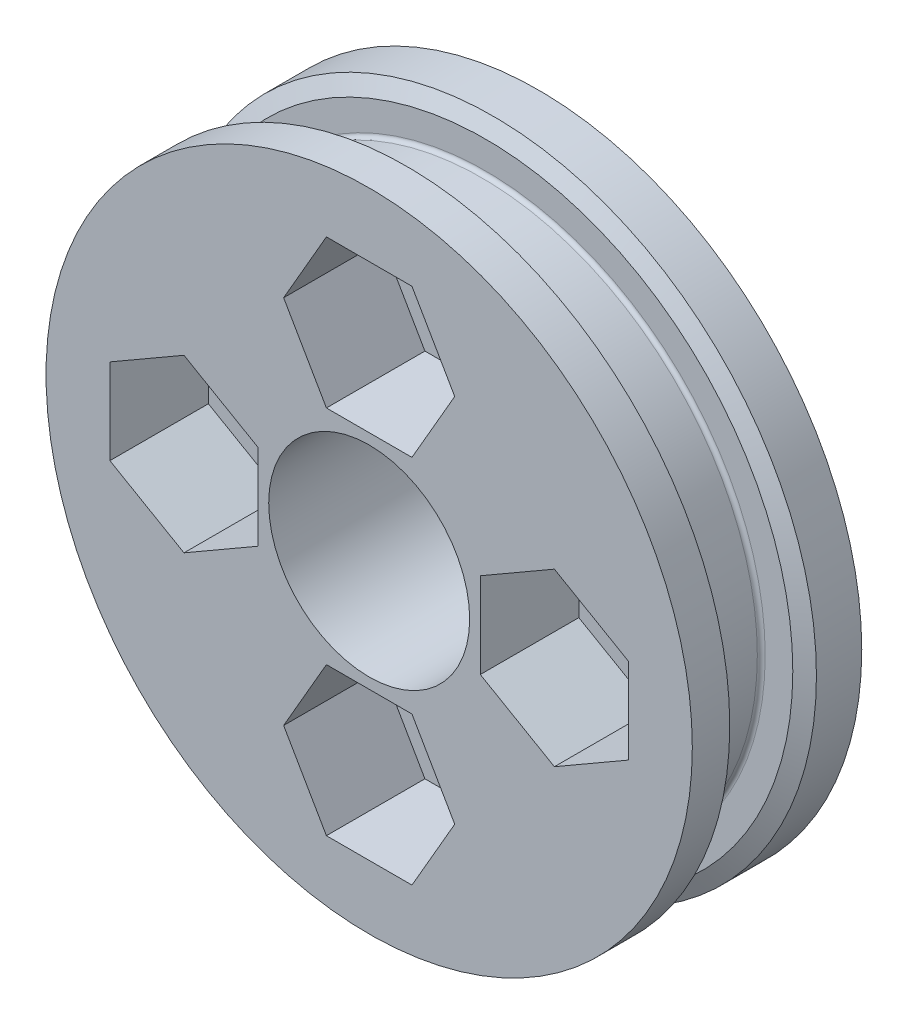
from build123d import *

# Parameters (mm, degrees)
SKETCH3_W               = 16.51
SKETCH3_H               = 16.51
SKETCH3_R               = 6.477
BOSS_EXTRUDE1_DEPTH     = 3.175
CUT_EXTRUDE1_DEPTH      = 32.414984514
CUT_EXTRUDE1_DEPTH_BACK = 32.414984514
SKETCH4_R               = 2.54
FILLET1_R               = 0.254
CUT_EXTRUDE2_DEPTH      = 6.35
CIRPATTERN1_COUNT       = 4


with BuildPart() as part:
    # Sketch2 → Revolve1 (revolve)
    with BuildSketch(Plane(origin=(0, 0, 0), x_dir=(0, 0, -1), z_dir=(1, 0, 0))):
        Polygon((0, 6.477), (0, 20.828), (2.413, 20.828), (2.921, 19.812), (2.921, 17.78), (7.493, 17.78), (7.493, 19.812), (8.001, 20.828), (10.922, 20.828), (10.922, 6.477), align=None)
    revolve(axis=Axis((0, 0, 0), (0, 0, -1)))

    # Sketch3 → Boss-Extrude1 (add)
    with BuildSketch(Plane(origin=(0, 0, -10.922), x_dir=(-1, 0, 0), z_dir=(0, 0, -1))):
        Rectangle(SKETCH3_W, SKETCH3_H)
        Circle(SKETCH3_R, mode=Mode.SUBTRACT)
    extrude(amount=BOSS_EXTRUDE1_DEPTH)

    # Sketch4 → Cut-Extrude1 (cut, two sides: drawn at the far end of the back side and taken through both)
    with BuildSketch(Plane(origin=(0, 0, -10.922), x_dir=(-1, 0, 0), z_dir=(0, 0, -1)).offset(-CUT_EXTRUDE1_DEPTH_BACK)):
        with Locations((0, 11.938)):
            Circle(SKETCH4_R)
        with Locations((11.938, 0)):
            Circle(SKETCH4_R)
        with Locations((0, -11.938)):
            Circle(SKETCH4_R)
        with Locations((-11.938, 0)):
            Circle(SKETCH4_R)
    extrude(amount=CUT_EXTRUDE1_DEPTH + CUT_EXTRUDE1_DEPTH_BACK, mode=Mode.SUBTRACT)

    # Fillet1
    fillet1_edges = [part.edges().sort_by_distance(p)[0] for p in [
        (0, -17.78, -7.493),
        (0, -17.78, -2.921),
    ]]
    fillet(fillet1_edges, radius=FILLET1_R)

    # Sketch5 → Cut-Extrude2 (cut)
    with BuildSketch(Plane.XY):
        Polygon((2.756963005, 7.1628), (5.513926011, 11.938), (2.756963005, 16.7132), (-2.756963005, 16.7132), (-5.513926011, 11.938), (-2.756963005, 7.1628), align=None)
    cut_extrude2 = extrude(amount=-CUT_EXTRUDE2_DEPTH, mode=Mode.SUBTRACT)

    # CirPattern1: Cut-Extrude2 ×4 about axis
    cirpattern1_axis = Axis((0, 0, 0), (0, 0, 1))
    for i in range(1, CIRPATTERN1_COUNT):
        add(cut_extrude2.rotate(cirpattern1_axis, i * 360 / CIRPATTERN1_COUNT), mode=Mode.SUBTRACT)


solid = part.part
